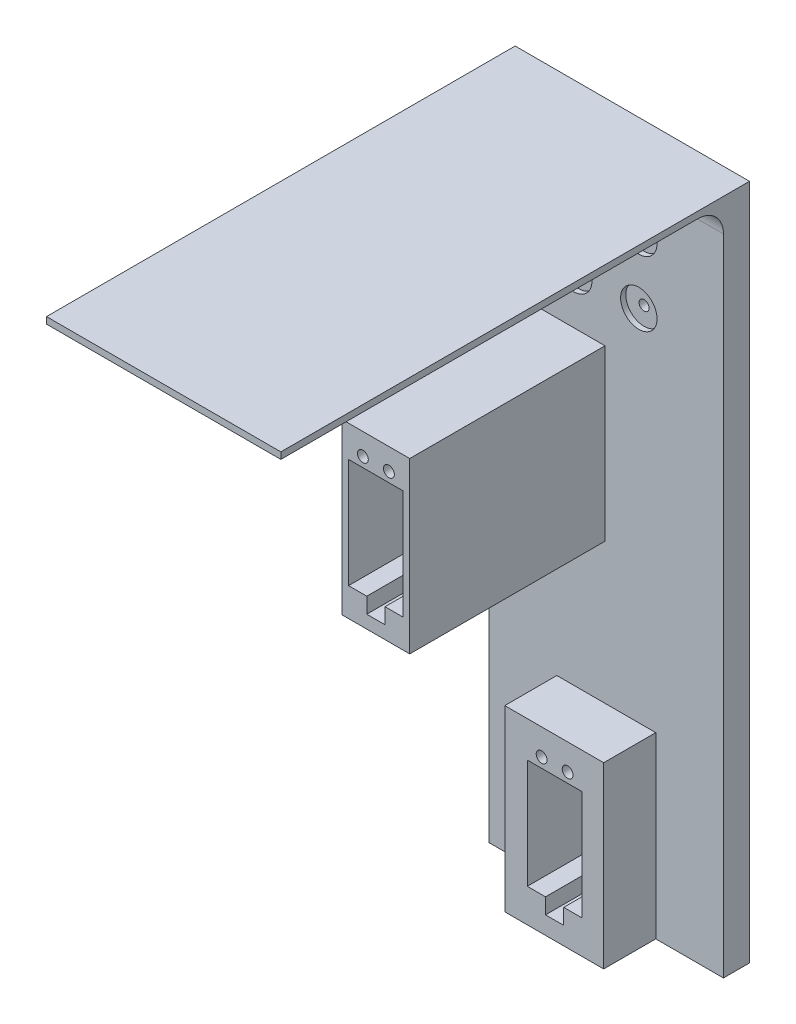
from build123d import *

# Parameters (mm, degrees)
SKETCH1_W           = 150
SKETCH1_H           = 200
BOSS_EXTRUDE1_DEPTH = 30
SKETCH2_W           = 150
SKETCH2_H           = 5
BOSS_EXTRUDE2_DEPTH = 150
SKETCH3_R           = 1.65
CUT_EXTRUDE3_DEPTH  = 80
SKETCH6_R           = 5
CUT_EXTRUDE5_DEPTH  = 22
SKETCH7_R           = 1.925
CUT_EXTRUDE6_DEPTH  = 5
FILLET1_R           = 5
SKETCH9_R           = 2.08
CUT_EXTRUDE7_DEPTH  = 30
BOSS_EXTRUDE5_START = -85
SKETCH12_R          = 2.08
BOSS_EXTRUDE5_DEPTH = 85
SKETCH13_W          = 150
SKETCH13_H          = 60
BOSS_EXTRUDE6_DEPTH = 30
SKETCH15_R          = 2.08
CUT_EXTRUDE8_DEPTH  = 30
SKETCH16_R          = 7
CUT_EXTRUDE9_DEPTH  = 22
SKETCH17_W          = 20
SKETCH17_H          = 260
CUT_EXTRUDE10_DEPTH = 180
SKETCH19_W          = 26
SKETCH19_H          = 65
CUT_EXTRUDE11_DEPTH = 20
SKETCH20_W          = 110
SKETCH20_H          = 7.480627484
CUT_EXTRUDE12_DEPTH = 200
FILLET2_R           = 10
SKETCH21_W          = 10
SKETCH21_H          = 260
CUT_EXTRUDE13_DEPTH = 200


with BuildPart() as part:
    # Sketch1 → Boss-Extrude1 (new body)
    with BuildSketch(Plane.XY):
        Rectangle(SKETCH1_W, SKETCH1_H)
    extrude(amount=BOSS_EXTRUDE1_DEPTH)

    # Sketch2 → Boss-Extrude2 (add)
    with BuildSketch(Plane.XY.offset(30)):
        with Locations((0, 97.5)):
            Rectangle(SKETCH2_W, SKETCH2_H)
    extrude(amount=BOSS_EXTRUDE2_DEPTH)

    # Sketch3 → Cut-Extrude3 (cut)
    with BuildSketch(Plane.XY.offset(30)):
        with Locations((-12.5, 46.5)):
            Circle(SKETCH3_R)
        with Locations((12.5, 46.5)):
            Circle(SKETCH3_R)
        with Locations((-12.5, 71.5)):
            Circle(SKETCH3_R)
        with Locations((12.5, 71.5)):
            Circle(SKETCH3_R)
    extrude(amount=-CUT_EXTRUDE3_DEPTH, mode=Mode.SUBTRACT)

    # Sketch6 → Cut-Extrude5 (cut)
    with BuildSketch(Plane.XY.offset(30)):
        with Locations((-12.5, 71.5)):
            Circle(SKETCH6_R)
        with Locations((12.5, 71.5)):
            Circle(SKETCH6_R)
        with Locations((-12.5, 46.5)):
            Circle(SKETCH6_R)
        with Locations((12.5, 46.5)):
            Circle(SKETCH6_R)
    extrude(amount=-CUT_EXTRUDE5_DEPTH, mode=Mode.SUBTRACT)

    # Sketch7 → Cut-Extrude6 (cut)
    with BuildSketch(Plane.XY.offset(8)):
        with Locations((-12.5, 71.5)):
            Circle(SKETCH7_R)
        with Locations((12.5, 71.5)):
            Circle(SKETCH7_R)
        with Locations((-12.5, 46.5)):
            Circle(SKETCH7_R)
        with Locations((12.5, 46.5)):
            Circle(SKETCH7_R)
    extrude(amount=-CUT_EXTRUDE6_DEPTH, mode=Mode.SUBTRACT)

    # Fillet1
    fillet1_edges = [part.edges().sort_by_distance(p)[0] for p in [
        (0, 95, 30),
    ]]
    fillet(fillet1_edges, radius=FILLET1_R)

    # Sketch9 → Cut-Extrude7 (cut)
    with BuildSketch(Plane.XY.offset(30)):
        Polygon((-3, -26.5), (-3, 15.5), (-24, 15.5), (-24, -26.5), (-17, -26.5), (-17, -32.5), (-10, -32.5), (-10, -26.5), align=None)
        with Locations((-8.5, 19.25)):
            Circle(SKETCH9_R)
        with Locations((-18.5, 19.25)):
            Circle(SKETCH9_R)
    extrude(amount=-CUT_EXTRUDE7_DEPTH, mode=Mode.SUBTRACT)

    # Sketch12 → Boss-Extrude5 (add)
    with BuildSketch(Plane(origin=(0, 0, 0), x_dir=(-1, 0, 0), z_dir=(0, 0, -1)).offset(BOSS_EXTRUDE5_START)):
        Polygon((0.5, -37.461410483), (13.5, -37.461410483), (26.5, -37.461410483), (26.5, 27.538589517), (0.5, 27.538589517), align=None)
        Polygon((3, 15.5), (13.5, 15.5), (24, 15.5), (24, -26.5), (17, -26.5), (17, -32.5), (13.5, -32.5), (10, -32.5), (10, -26.5), (3, -26.5), align=None, mode=Mode.SUBTRACT)
        with Locations((8.5, 19.25)):
            Circle(SKETCH12_R, mode=Mode.SUBTRACT)
        with Locations((18.5, 19.25)):
            Circle(SKETCH12_R, mode=Mode.SUBTRACT)
    extrude(amount=BOSS_EXTRUDE5_DEPTH)

    # Sketch13 → Boss-Extrude6 (add)
    with BuildSketch(Plane(origin=(0, 0, 0), x_dir=(-1, 0, 0), z_dir=(0, 0, -1))):
        with Locations((0, -130)):
            Rectangle(SKETCH13_W, SKETCH13_H)
    extrude(amount=-BOSS_EXTRUDE6_DEPTH)

    # Sketch15 → Cut-Extrude8 (cut)
    with BuildSketch(Plane.XY.offset(30)):
        with Locations((-4.843183012, -101.421536398)):
            Circle(SKETCH15_R)
        with Locations((5.156816988, -101.421536398)):
            Circle(SKETCH15_R)
        Polygon((-10.343183012, -105.171536398), (10.656816988, -105.171536398), (10.656816988, -147.171536398), (3.656816988, -147.171536398), (3.656816988, -153.171536398), (-3.343183012, -153.171536398), (-3.343183012, -147.171536398), (-10.343183012, -147.171536398), align=None)
    extrude(amount=-CUT_EXTRUDE8_DEPTH, mode=Mode.SUBTRACT)

    # Sketch16 → Cut-Extrude9 (cut)
    with BuildSketch(Plane.XY.offset(30)):
        with Locations((-12.5, 71.5)):
            Circle(SKETCH16_R)
        with Locations((12.5, 71.5)):
            Circle(SKETCH16_R)
        with Locations((12.5, 46.5)):
            Circle(SKETCH16_R)
        with Locations((-12.5, 46.5)):
            Circle(SKETCH16_R)
    extrude(amount=-CUT_EXTRUDE9_DEPTH, mode=Mode.SUBTRACT)

    # Sketch17 → Cut-Extrude10 (cut)
    with BuildSketch(Plane(origin=(0, 0, 0), x_dir=(-1, 0, 0), z_dir=(0, 0, -1))):
        with Locations((65, -30)):
            Rectangle(SKETCH17_W, SKETCH17_H)
        with Locations((-65, -30)):
            Rectangle(SKETCH17_W, SKETCH17_H)
    extrude(amount=-CUT_EXTRUDE10_DEPTH, mode=Mode.SUBTRACT)

    # Sketch19 → Cut-Extrude11 (cut)
    with BuildSketch(Plane.XY.offset(30)):
        Polygon((-55, 90), (55, 90), (55, -160), (19, -160), (19, -91.388207499), (-19, -91.388207499), (-19, -160), (-55, -160), align=None)
        with Locations((-13.5, -4.961410483)):
            Rectangle(SKETCH19_W, SKETCH19_H, mode=Mode.SUBTRACT)
    extrude(amount=-CUT_EXTRUDE11_DEPTH, mode=Mode.SUBTRACT)

    # Sketch20 → Cut-Extrude12 (cut)
    with BuildSketch(Plane.XY.offset(10)):
        with Locations((0, 93.740313742)):
            Rectangle(SKETCH20_W, SKETCH20_H)
    extrude(amount=CUT_EXTRUDE12_DEPTH, mode=Mode.SUBTRACT)

    # Fillet2
    fillet2_edges = [part.edges().sort_by_distance(p)[0] for p in [
        (0, 97.480627484, 10),
    ]]
    fillet(fillet2_edges, radius=FILLET2_R)

    # Sketch21 → Cut-Extrude13 (cut)
    with BuildSketch(Plane(origin=(0, 0, 0), x_dir=(-1, 0, 0), z_dir=(0, 0, -1))):
        with Locations((50, -30)):
            Rectangle(SKETCH21_W, SKETCH21_H)
        with Locations((-50, -30)):
            Rectangle(SKETCH21_W, SKETCH21_H)
    extrude(amount=-CUT_EXTRUDE13_DEPTH, mode=Mode.SUBTRACT)


solid = part.part
